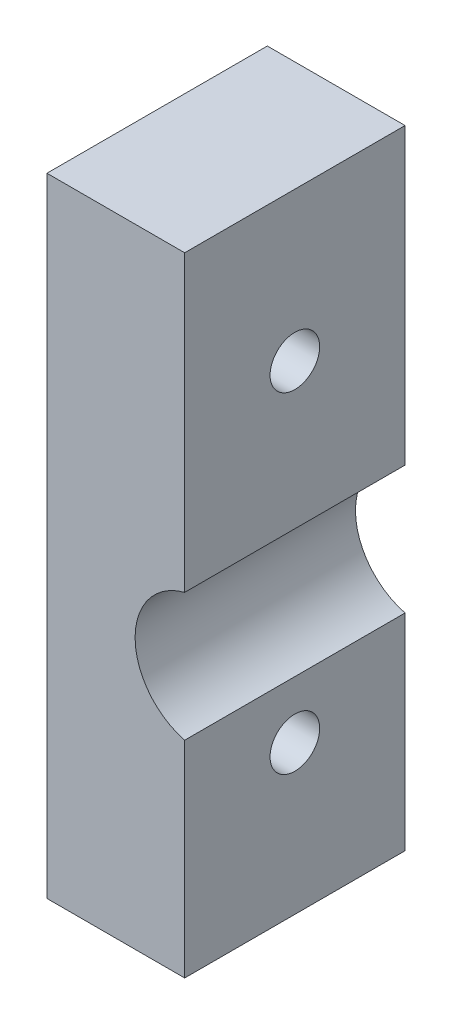
from build123d import *

# Parameters (mm, degrees)
BOSS_EXTRUDE1_DEPTH                          = 10
BOSS_EXTRUDE1_2_DEPTH                        = 10
CBORE_FOR_M5_HEX_SOCKET_HEAD_CAP_SCR_2_COUNT = 2
CBORE_FOR_M5_HEX_SOCKET_HEAD_CAP_SCR_2_PITCH = 30
BOSS_EXTRUDE2_DEPTH                          = 13
BOSS_EXTRUDE3_DEPTH                          = 23
BOSS_EXTRUDE4_DEPTH                          = 27
SKETCH8_R                                    = 2.1
CUT_EXTRUDE1_DEPTH                           = 52.298148115
CHAMFER1_SIZE                                = 16
CUT_EXTRUDE2_DEPTH                           = 6
SKETCH10_R                                   = 5
SKETCH10_R_2                                 = 2.1
BOSS_EXTRUDE5_DEPTH                          = 0.7
CHAMFER2_SIZE                                = 1


with BuildPart() as part:
    # Sketch1 → Boss-Extrude1 (new, symmetric)
    with BuildSketch(Plane.XY):
        with BuildLine():
            Line((-14, 32.5), (-1.5, 32.5))
            Line((-1.5, 32.5), (-1.5, 5.809475019))
            ThreePointArc((-1.5, 5.809475019), (-6, 0), (-1.5, -5.809475019))
            Line((-1.5, -5.809475019), (-1.5, -24.5))
            Line((-1.5, -24.5), (-14, -24.5))
            Line((-14, -24.5), (-14, 32.5))
        make_face()
    extrude(amount=BOSS_EXTRUDE1_DEPTH, both=True)


with BuildPart() as body_2:
    # Sketch1 → Boss-Extrude1 2 (new, symmetric)
    with BuildSketch(Plane.XY):
        with BuildLine():
            Line((15, 33.5), (15, 23))
            Line((15, 23), (15.6, 23))
            Line((15.6, 23), (15.6, 15))
            Line((15.6, 15), (15, 15))
            Line((15, 15), (15, -7))
            Line((15, -7), (15.6, -7))
            Line((15.6, -7), (15.6, -15))
            Line((15.6, -15), (15, -15))
            Line((15, -15), (15, -25.5))
            Line((15, -25.5), (1.5, -25.5))
            Line((1.5, -25.5), (1.5, -5.809475019))
            ThreePointArc((1.5, -5.809475019), (6, 0), (1.5, 5.809475019))
            Line((1.5, 5.809475019), (1.5, 33.5))
            Line((1.5, 33.5), (15, 33.5))
        make_face()
    extrude(amount=BOSS_EXTRUDE1_2_DEPTH, both=True)


with BuildPart() as cbore_for_m5_hex_socket_head_cap_screw1_tool:
    # Sketch2 → CBORE for M5 Hex Socket Head Cap Screw1 (revolve)
    with BuildSketch(Plane(origin=(-14, -11, 0), x_dir=(0, 0, 1), z_dir=(0, 1, 0))):
        Polygon((0, 0), (0, 29.6), (2.25, 29.6), (2.25, 5.9), (5, 5.9), (5, 0), align=None)
    cbore_for_m5_hex_socket_head_cap_screw1 = revolve(axis=Axis((-20.35, -11, 0), (1, 0, 0)))


with BuildPart() as part_1:
    add(part.part)

    # CBORE for M5 Hex Socket Head Cap Screw1: cut by cbore_for_m5_hex_socket_head_cap_screw1_tool
    add(cbore_for_m5_hex_socket_head_cap_screw1_tool.part, mode=Mode.SUBTRACT)


with BuildPart() as body_2_1:
    add(body_2.part)

    # CBORE for M5 Hex Socket Head Cap Screw1: cut by cbore_for_m5_hex_socket_head_cap_screw1_tool
    add(cbore_for_m5_hex_socket_head_cap_screw1_tool.part, mode=Mode.SUBTRACT)


with BuildPart() as cbore_for_m5_hex_socket_head_cap_scr_2_tool:
    # CBORE for M5 Hex Socket Head Cap Scr 2: CBORE for M5 Hex Socket Head Cap Screw1 ×2
    with Locations(*[(0, i * CBORE_FOR_M5_HEX_SOCKET_HEAD_CAP_SCR_2_PITCH, 0) for i in range(1, CBORE_FOR_M5_HEX_SOCKET_HEAD_CAP_SCR_2_COUNT)]):
        add(cbore_for_m5_hex_socket_head_cap_screw1)


with BuildPart() as part_2:
    add(part_1.part)

    # CBORE for M5 Hex Socket Head Cap Scr 2: cut by cbore_for_m5_hex_socket_head_cap_scr_2_tool
    add(cbore_for_m5_hex_socket_head_cap_scr_2_tool.part, mode=Mode.SUBTRACT)


with BuildPart() as body_2_2:
    add(body_2_1.part)

    # CBORE for M5 Hex Socket Head Cap Scr 2: cut by cbore_for_m5_hex_socket_head_cap_scr_2_tool
    add(cbore_for_m5_hex_socket_head_cap_scr_2_tool.part, mode=Mode.SUBTRACT)

    # Sketch4 → Boss-Extrude2 (add)
    with BuildSketch(Plane.XY.offset(10)):
        Polygon((1.5, 5.809475019), (1.5, -5.809475019), (1.5, -25.5), (15, -25.5), (15, -15), (15.6, -15), (15.6, -7), (15, -7), (15, 15), (15.6, 15), (15.6, 23), (15, 23), (15, 33.5), (1.5, 33.5), align=None)
    extrude(amount=BOSS_EXTRUDE2_DEPTH)

    # Sketch5 → Boss-Extrude3 (add)
    with BuildSketch(Plane(origin=(0, 0, -10), x_dir=(-1, 0, 0), z_dir=(0, 0, -1))):
        with BuildLine():
            Line((-15, -25.5), (-1.5, -25.5))
            Line((-1.5, -25.5), (-1.5, -5.809475019))
            ThreePointArc((-1.5, -5.809475019), (-6, 0), (-1.5, 5.809475019))
            Line((-1.5, 5.809475019), (-1.5, 33.5))
            Line((-1.5, 33.5), (-15, 33.5))
            Line((-15, 33.5), (-15, 23))
            Line((-15, 23), (-15.6, 23))
            Line((-15.6, 23), (-15.6, 15))
            Line((-15.6, 15), (-15, 15))
            Line((-15, 15), (-15, -7))
            Line((-15, -7), (-15.6, -7))
            Line((-15.6, -7), (-15.6, -15))
            Line((-15.6, -15), (-15, -15))
            Line((-15, -15), (-15, -25.5))
        make_face()
    extrude(amount=BOSS_EXTRUDE3_DEPTH)

    # Sketch7 → Boss-Extrude4 (add)
    with BuildSketch(Plane(origin=(0, 33.5, 0), x_dir=(1, 0, 0), z_dir=(0, 1, 0))):
        Polygon((1.5, 33), (-4.9, 33), (-4.9, 17.4), (1.5, 11), align=None)
    extrude(amount=-BOSS_EXTRUDE4_DEPTH)

    # Sketch8 → Cut-Extrude1 (cut, through all)
    with BuildSketch(Plane.ZY.offset(4.9)):
        with Locations((-25, 19)):
            Circle(SKETCH8_R)
    extrude(amount=-CUT_EXTRUDE1_DEPTH, mode=Mode.SUBTRACT)

    # Chamfer1
    chamfer1_edges = [body_2_2.edges().sort_by_distance(p)[0] for p in [
        (8.25, -25.5, -33),
    ]]
    chamfer(chamfer1_edges, length=CHAMFER1_SIZE)

    # Sketch9 → Cut-Extrude2 (cut)
    with BuildSketch(Plane(origin=(15.6, 0, 0), x_dir=(0, 0, -1), z_dir=(1, 0, 0))):
        Polygon((29.099186911, 19), (27.049593456, 22.55), (22.950406544, 22.55), (20.900813089, 19), (22.950406544, 15.45), (27.049593456, 15.45), align=None)
    extrude(amount=-CUT_EXTRUDE2_DEPTH, mode=Mode.SUBTRACT)

    # Sketch10 → Boss-Extrude5 (add)
    with BuildSketch(Plane.ZY.offset(4.9)):
        with Locations((-25, 19)):
            Circle(SKETCH10_R)
        with Locations((-25, 19)):
            Circle(SKETCH10_R_2, mode=Mode.SUBTRACT)
    extrude(amount=BOSS_EXTRUDE5_DEPTH)

    # Chamfer2
    # the kernel refuses this chamfer: 1 mm, written as the material it takes off along each edge
    with BuildSketch(Plane(origin=(-5.6, 19, -25), x_dir=(0, 0, 1), z_dir=(0, -1, 0))) as chamfer2_piece_1_section:
        Polygon((5, -CHAMFER2_SIZE), (5 - CHAMFER2_SIZE, 0), (5, 0), align=None)
    chamfer2_piece_1 = revolve(axis=Axis((-5.6, 19, -25), (-1, 0, 0)), mode=Mode.PRIVATE)
    chamfer2_piece_1 = split(chamfer2_piece_1, bisect_by=Plane(origin=(-4.9, 19, -29.353058273), z_dir=(-1, 0, 0)), keep=Keep.TOP, mode=Mode.PRIVATE)
    add(chamfer2_piece_1, mode=Mode.SUBTRACT)


solid = part_2.part
